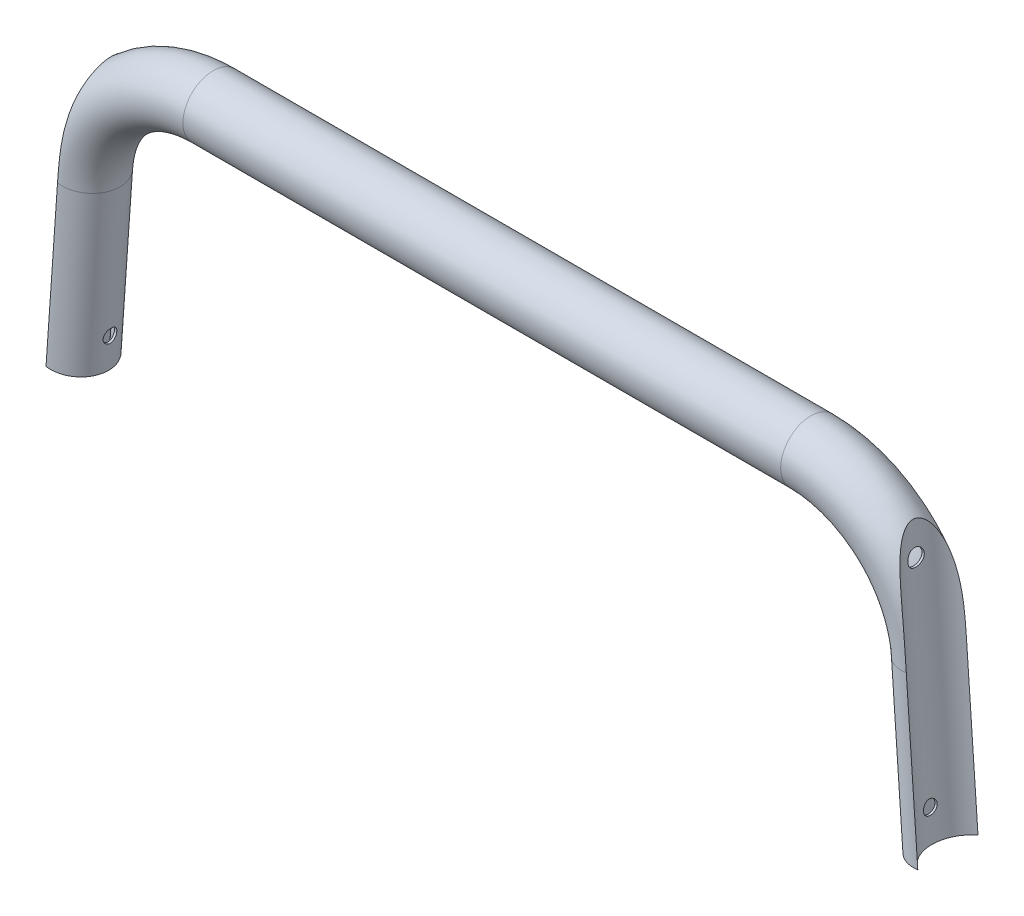
from build123d import *

# Parameters (mm, degrees)
SKETCH2_R               = 11
SKETCH2_R_2             = 10.2
CUT_EXTRUDE1_START      = -99.377479742
CUT_EXTRUDE1_DEPTH      = 99.377479742
BOSS_EXTRUDE1_REACH     = 209.611
CUT_EXTRUDE2_REACH      = 338.545
CUT_EXTRUDE2_END_RADIUS = 10.999999999999993
SKETCH8_R               = 2.5000000000000004
CUT_EXTRUDE3_REACH      = 355.728
SKETCH9_R               = 3.0000000000000013


# Read off the part's stored shape, not the designer's step: Cut-Extrude1
with BuildPart() as part:
    # Sweep1: sweep along a path in Sketch1
    with BuildLine(Plane.XY) as sweep1_path:
        Line((-157.99999999999997, -100.14044362026188), (-153.80166124845385, -40.101402301776396))
        ThreePointArc((-153.80166124845385, -40.101402301776396), (-139.60120518957422, -10.329527047399267), (-108.9112789867617, 1.7595563797381253))
        Line((-108.9112789867617, 1.7595563797381253), (108.9112789867617, 1.7595563797381253))
        ThreePointArc((108.9112789867617, 1.7595563797381253), (139.60120518957382, -10.329527047399274), (153.8016612484534, -40.10140230177606))
        Line((153.8016612484534, -40.10140230177606), (158.00000000000003, -100.14044362026188))
    # Sketch2 → Sweep1 (sweep)
    with BuildSketch(Plane(origin=(-158, -100.14044362026188, 0), x_dir=(-0.9975640502598245, 0.06975647374412194, 0), z_dir=(-0.06975647374412194, -0.9975640502598245, 0))):
        Circle(SKETCH2_R)
        Circle(SKETCH2_R_2, mode=Mode.SUBTRACT)
    sweep(path=sweep1_path.line)

    # Cut-Extrude1 outline → Cut-Extrude1 (cut)
    with BuildSketch(Plane(origin=(7.7372506044904945, -110.64783863935695, 0), x_dir=(0.9975640502598241, 0.06975647374412848, 0), z_dir=(0.06975647374412847, -0.997564050259824, 0)).offset(CUT_EXTRUDE1_START)):
        with BuildLine():
            ThreePointArc((151.483334252, -10.966825753), (161.629675715, 0), (151.483334252, 10.966825753))
            ThreePointArc((151.483334252, 10.966825753), (145.629675715, 0), (151.483334252, -10.966825753))
        make_face()
    cut_extrude1 = extrude(amount=CUT_EXTRUDE1_DEPTH, mode=Mode.SUBTRACT)

    # Mirror1: Cut-Extrude1 across plane
    add(cut_extrude1.mirror(Plane(origin=(0, 0, 0), x_dir=(0, 0, 1), z_dir=(1, 0, 0))), mode=Mode.SUBTRACT)

    # Sketch6 → Boss-Extrude1 (add, up to next)
    with BuildSketch(Plane(origin=(7.737250604490494, -110.64783863935693, 0), x_dir=(0.9975640502598241, 0.06975647374412848, 0), z_dir=(0.06975647374412848, -0.9975640502598241, 0)), mode=Mode.PRIVATE) as boss_extrude1_sk1:
        with BuildLine():
            ThreePointArc((158.08424585583222, 13.178935250055874), (145.62967571493013, 1.62e-15), (158.08424585583222, -13.178935250055874))
            ThreePointArc((158.08424585583222, -13.178935250055874), (157.42901134581956, -13.528635751224583), (156.75741658753958, -13.84578427207885))
            ThreePointArc((156.75741658753958, -13.84578427207885), (144.82967571493015, 1.71e-15), (156.75741658753958, 13.845784272078852))
            ThreePointArc((156.75741658753958, 13.845784272078852), (157.42901134581956, 13.52863575122458), (158.08424585583222, 13.178935250055874))
        make_face()
    boss_extrude1_tool1 = extrude(boss_extrude1_sk1.sketch, amount=-BOSS_EXTRUDE1_REACH, mode=Mode.PRIVATE) - part.part
    boss_extrude1 = boss_extrude1_tool1.solids().sort_by_distance((152.520383, -100.523616, 0))[0]
    add(boss_extrude1)

    # Mirror2: Boss-Extrude1 across plane
    add(boss_extrude1.mirror(Plane(origin=(0, 0, 0), x_dir=(0, 0, 1), z_dir=(1, 0, 0))))

    # Cut-Extrude2: up to this cylinder (the profile starts inside it)
    cut_extrude2_end = Plane(origin=(157.20462344570205, -88.76602896883347, 0), z_dir=(0.06975647374412888, -0.997564050259824, 0)) * Cylinder(CUT_EXTRUDE2_END_RADIUS, 700.09, mode=Mode.PRIVATE)
    # Sketch8 → Cut-Extrude2 (cut, up to the surface)
    with BuildSketch(Plane(origin=(158.00000000000009, -100.14044362026183, 0), x_dir=(0, -1e-17, -1), z_dir=(0.9975640502598242, 0.0697564737441279, 0)), mode=Mode.PRIVATE) as cut_extrude2_sk1:
        with Locations(Location((0, 11.40218999047264, 0), (0, 0, 90))):
            Circle(SKETCH8_R)
    cut_extrude2_tool1 = extrude(cut_extrude2_sk1.sketch, amount=-CUT_EXTRUDE2_REACH, mode=Mode.PRIVATE) & cut_extrude2_end
    cut_extrude2 = cut_extrude2_tool1.solids().sort_by_distance((157.204623, -88.766029, 0))[0]
    add(cut_extrude2, mode=Mode.SUBTRACT)

    # Mirror3: Cut-Extrude2 across plane
    add(cut_extrude2.mirror(Plane(origin=(0, 0, 0), x_dir=(0, 0, 1), z_dir=(1, 0, 0))), mode=Mode.SUBTRACT)

    # Sketch9 → Cut-Extrude3 (cut, up to next)
    with BuildSketch(Plane(origin=(180, 0, 0), x_dir=(0, 0, -1), z_dir=(1, 0, 0)), mode=Mode.PRIVATE) as cut_extrude3_sk1:
        with Locations((0, -12.919035994652349)):
            Circle(SKETCH9_R)
    cut_extrude3_tool1 = extrude(cut_extrude3_sk1.sketch, amount=-CUT_EXTRUDE3_REACH, mode=Mode.PRIVATE) & part.part
    add(cut_extrude3_tool1.solids().sort_by_distance((180, -12.919036, 0))[0], mode=Mode.SUBTRACT)


solid = part.part
